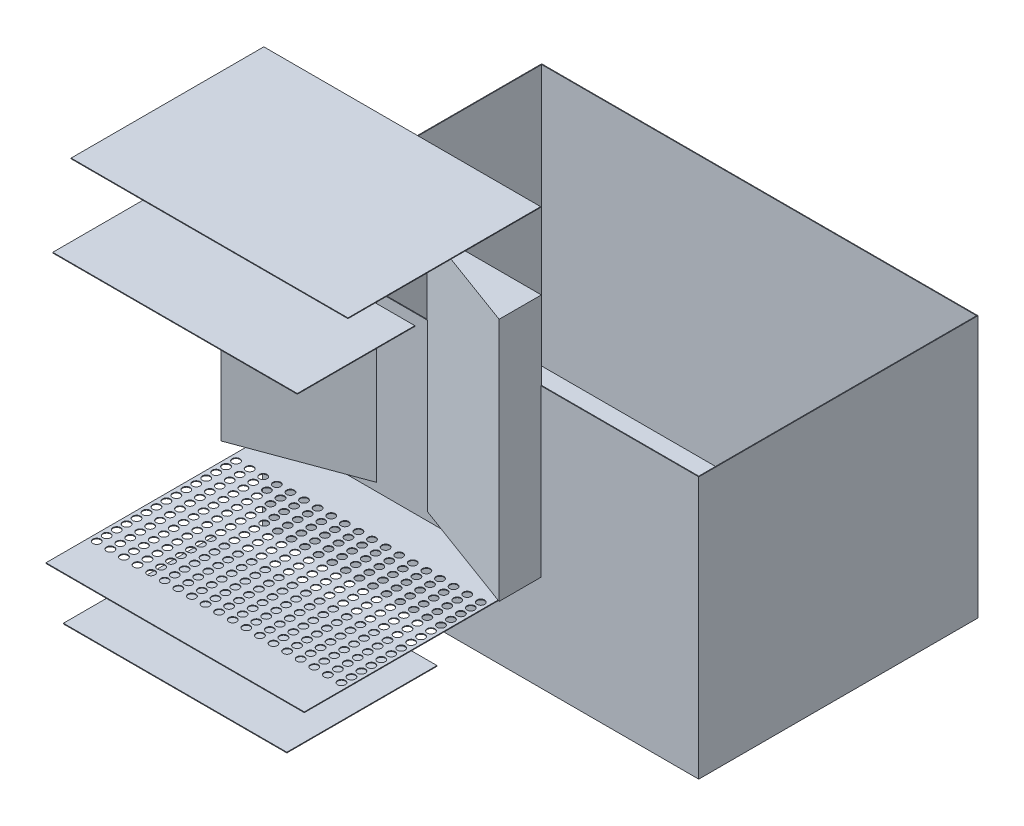
from build123d import *

# Parameters (mm, degrees)
MASTER_FOOTPRINT_W            = 1250
MASTER_FOOTPRINT_H            = 800
BATH_BASE_PLATE_DEPTH         = 750
BATH_SHELL_2MM_T              = -2
INLET_IMPACT_BAFFLE_START     = 125
SKETCH_1_W                    = 640
SKETCH_1_H                    = 430
INLET_IMPACT_BAFFLE_DEPTH     = 2
DISTRIBUTOR_D22_START         = 250
SKETCH_2_W                    = 740
SKETCH_2_H                    = 652
SKETCH_2_R                    = 11
DISTRIBUTOR_D22_DEPTH         = 2
OUTLET_SUBMERGED_BAFFLE_START = 1030
SKETCH_3_W                    = 700.526315789
SKETCH_3_H                    = 336.5
OUTLET_SUBMERGED_BAFFLE_DEPTH = 2
OVERFLOW_WEIR_Z550_START      = 1190
SKETCH_4_W                    = 793
SKETCH_4_H                    = 552
OVERFLOW_WEIR_Z550_DEPTH      = 2
SLOPED_SEDIMENT_FLOOR_START   = 275
SLOPED_SEDIMENT_FLOOR_DEPTH   = 700


with BuildPart() as part:
    # MASTER_FOOTPRINT → BATH_BASE_PLATE (new body)
    with BuildSketch(Plane(origin=(0, 0, 0), x_dir=(1, 0, 0), z_dir=(0, 1, 0))):
        with Locations((625, 400)):
            Rectangle(MASTER_FOOTPRINT_W, MASTER_FOOTPRINT_H)
    extrude(amount=BATH_BASE_PLATE_DEPTH)

    # BATH_SHELL_2MM
    bath_shell_2mm_openings = [part.faces().sort_by_distance(p)[0] for p in [
        (625, 750, -400),
    ]]
    offset(amount=BATH_SHELL_2MM_T, openings=bath_shell_2mm_openings, kind=Kind.INTERSECTION)

    # Эскиз5 → SLOPED_SEDIMENT_FLOOR (add)
    with BuildSketch(Plane(origin=(0, 0, 0), x_dir=(1, 0, 0), z_dir=(0, 1, 0)).offset(SLOPED_SEDIMENT_FLOOR_START)):
        Polygon((2, 1), (2, -120), (330, 1), align=None)
        Polygon((798, 1), (798, -120), (470, 1), align=None)
    extrude(amount=SLOPED_SEDIMENT_FLOOR_DEPTH)


with BuildPart() as body_2:
    # Эскиз1 → INLET_IMPACT_BAFFLE (new body)
    with BuildSketch(Plane(origin=(0, 0, 0), x_dir=(1, 0, 0), z_dir=(0, 1, 0)).offset(INLET_IMPACT_BAFFLE_START)):
        with Locations((400, -435)):
            Rectangle(SKETCH_1_W, SKETCH_1_H)
    extrude(amount=INLET_IMPACT_BAFFLE_DEPTH)


with BuildPart() as body_3:
    # Эскиз2 → DISTRIBUTOR_D22 (new body)
    with BuildSketch(Plane(origin=(0, 0, 0), x_dir=(1, 0, 0), z_dir=(0, 1, 0)).offset(DISTRIBUTOR_D22_START)):
        with Locations((400, -324)):
            Rectangle(SKETCH_2_W, SKETCH_2_H)
        with Locations((49.473684211, -125)):
            Circle(SKETCH_2_R, mode=Mode.SUBTRACT)
        with Locations((49.473684211, -153.5)):
            Circle(SKETCH_2_R, mode=Mode.SUBTRACT)
        with Locations((49.473684211, -182)):
            Circle(SKETCH_2_R, mode=Mode.SUBTRACT)
        with Locations((49.473684211, -210.5)):
            Circle(SKETCH_2_R, mode=Mode.SUBTRACT)
        with Locations((49.473684211, -239)):
            Circle(SKETCH_2_R, mode=Mode.SUBTRACT)
        with Locations((49.473684211, -267.5)):
            Circle(SKETCH_2_R, mode=Mode.SUBTRACT)
        with Locations((49.473684211, -296)):
            Circle(SKETCH_2_R, mode=Mode.SUBTRACT)
        with Locations((49.473684211, -324.5)):
            Circle(SKETCH_2_R, mode=Mode.SUBTRACT)
        with Locations((49.473684211, -353)):
            Circle(SKETCH_2_R, mode=Mode.SUBTRACT)
        with Locations((49.473684211, -381.5)):
            Circle(SKETCH_2_R, mode=Mode.SUBTRACT)
        with Locations((49.473684211, -410)):
            Circle(SKETCH_2_R, mode=Mode.SUBTRACT)
        with Locations((49.473684211, -438.5)):
            Circle(SKETCH_2_R, mode=Mode.SUBTRACT)
        with Locations((49.473684211, -467)):
            Circle(SKETCH_2_R, mode=Mode.SUBTRACT)
        with Locations((49.473684211, -495.5)):
            Circle(SKETCH_2_R, mode=Mode.SUBTRACT)
        with Locations((49.473684211, -524)):
            Circle(SKETCH_2_R, mode=Mode.SUBTRACT)
        with Locations((88.421052632, -125)):
            Circle(SKETCH_2_R, mode=Mode.SUBTRACT)
        with Locations((88.421052632, -153.5)):
            Circle(SKETCH_2_R, mode=Mode.SUBTRACT)
        with Locations((88.421052632, -182)):
            Circle(SKETCH_2_R, mode=Mode.SUBTRACT)
        with Locations((88.421052632, -210.5)):
            Circle(SKETCH_2_R, mode=Mode.SUBTRACT)
        with Locations((88.421052632, -239)):
            Circle(SKETCH_2_R, mode=Mode.SUBTRACT)
        with Locations((88.421052632, -267.5)):
            Circle(SKETCH_2_R, mode=Mode.SUBTRACT)
        with Locations((88.421052632, -296)):
            Circle(SKETCH_2_R, mode=Mode.SUBTRACT)
        with Locations((88.421052632, -324.5)):
            Circle(SKETCH_2_R, mode=Mode.SUBTRACT)
        with Locations((88.421052632, -353)):
            Circle(SKETCH_2_R, mode=Mode.SUBTRACT)
        with Locations((88.421052632, -381.5)):
            Circle(SKETCH_2_R, mode=Mode.SUBTRACT)
        with Locations((88.421052632, -410)):
            Circle(SKETCH_2_R, mode=Mode.SUBTRACT)
        with Locations((88.421052632, -438.5)):
            Circle(SKETCH_2_R, mode=Mode.SUBTRACT)
        with Locations((88.421052632, -467)):
            Circle(SKETCH_2_R, mode=Mode.SUBTRACT)
        with Locations((88.421052632, -495.5)):
            Circle(SKETCH_2_R, mode=Mode.SUBTRACT)
        with Locations((88.421052632, -524)):
            Circle(SKETCH_2_R, mode=Mode.SUBTRACT)
        with Locations((127.368421053, -125)):
            Circle(SKETCH_2_R, mode=Mode.SUBTRACT)
        with Locations((127.368421053, -153.5)):
            Circle(SKETCH_2_R, mode=Mode.SUBTRACT)
        with Locations((127.368421053, -182)):
            Circle(SKETCH_2_R, mode=Mode.SUBTRACT)
        with Locations((127.368421053, -210.5)):
            Circle(SKETCH_2_R, mode=Mode.SUBTRACT)
        with Locations((127.368421053, -239)):
            Circle(SKETCH_2_R, mode=Mode.SUBTRACT)
        with Locations((127.368421053, -267.5)):
            Circle(SKETCH_2_R, mode=Mode.SUBTRACT)
        with Locations((127.368421053, -296)):
            Circle(SKETCH_2_R, mode=Mode.SUBTRACT)
        with Locations((127.368421053, -324.5)):
            Circle(SKETCH_2_R, mode=Mode.SUBTRACT)
        with Locations((127.368421053, -353)):
            Circle(SKETCH_2_R, mode=Mode.SUBTRACT)
        with Locations((127.368421053, -381.5)):
            Circle(SKETCH_2_R, mode=Mode.SUBTRACT)
        with Locations((127.368421053, -410)):
            Circle(SKETCH_2_R, mode=Mode.SUBTRACT)
        with Locations((127.368421053, -438.5)):
            Circle(SKETCH_2_R, mode=Mode.SUBTRACT)
        with Locations((127.368421053, -467)):
            Circle(SKETCH_2_R, mode=Mode.SUBTRACT)
        with Locations((127.368421053, -495.5)):
            Circle(SKETCH_2_R, mode=Mode.SUBTRACT)
        with Locations((127.368421053, -524)):
            Circle(SKETCH_2_R, mode=Mode.SUBTRACT)
        with Locations((166.315789474, -125)):
            Circle(SKETCH_2_R, mode=Mode.SUBTRACT)
        with Locations((166.315789474, -153.5)):
            Circle(SKETCH_2_R, mode=Mode.SUBTRACT)
        with Locations((166.315789474, -182)):
            Circle(SKETCH_2_R, mode=Mode.SUBTRACT)
        with Locations((166.315789474, -210.5)):
            Circle(SKETCH_2_R, mode=Mode.SUBTRACT)
        with Locations((166.315789474, -239)):
            Circle(SKETCH_2_R, mode=Mode.SUBTRACT)
        with Locations((166.315789474, -267.5)):
            Circle(SKETCH_2_R, mode=Mode.SUBTRACT)
        with Locations((166.315789474, -296)):
            Circle(SKETCH_2_R, mode=Mode.SUBTRACT)
        with Locations((166.315789474, -324.5)):
            Circle(SKETCH_2_R, mode=Mode.SUBTRACT)
        with Locations((166.315789474, -353)):
            Circle(SKETCH_2_R, mode=Mode.SUBTRACT)
        with Locations((166.315789474, -381.5)):
            Circle(SKETCH_2_R, mode=Mode.SUBTRACT)
        with Locations((166.315789474, -410)):
            Circle(SKETCH_2_R, mode=Mode.SUBTRACT)
        with Locations((166.315789474, -438.5)):
            Circle(SKETCH_2_R, mode=Mode.SUBTRACT)
        with Locations((166.315789474, -467)):
            Circle(SKETCH_2_R, mode=Mode.SUBTRACT)
        with Locations((166.315789474, -495.5)):
            Circle(SKETCH_2_R, mode=Mode.SUBTRACT)
        with Locations((166.315789474, -524)):
            Circle(SKETCH_2_R, mode=Mode.SUBTRACT)
        with Locations((205.263157895, -125)):
            Circle(SKETCH_2_R, mode=Mode.SUBTRACT)
        with Locations((205.263157895, -153.5)):
            Circle(SKETCH_2_R, mode=Mode.SUBTRACT)
        with Locations((205.263157895, -182)):
            Circle(SKETCH_2_R, mode=Mode.SUBTRACT)
        with Locations((205.263157895, -210.5)):
            Circle(SKETCH_2_R, mode=Mode.SUBTRACT)
        with Locations((205.263157895, -239)):
            Circle(SKETCH_2_R, mode=Mode.SUBTRACT)
        with Locations((205.263157895, -267.5)):
            Circle(SKETCH_2_R, mode=Mode.SUBTRACT)
        with Locations((205.263157895, -296)):
            Circle(SKETCH_2_R, mode=Mode.SUBTRACT)
        with Locations((205.263157895, -324.5)):
            Circle(SKETCH_2_R, mode=Mode.SUBTRACT)
        with Locations((205.263157895, -353)):
            Circle(SKETCH_2_R, mode=Mode.SUBTRACT)
        with Locations((205.263157895, -381.5)):
            Circle(SKETCH_2_R, mode=Mode.SUBTRACT)
        with Locations((205.263157895, -410)):
            Circle(SKETCH_2_R, mode=Mode.SUBTRACT)
        with Locations((205.263157895, -438.5)):
            Circle(SKETCH_2_R, mode=Mode.SUBTRACT)
        with Locations((205.263157895, -467)):
            Circle(SKETCH_2_R, mode=Mode.SUBTRACT)
        with Locations((205.263157895, -495.5)):
            Circle(SKETCH_2_R, mode=Mode.SUBTRACT)
        with Locations((205.263157895, -524)):
            Circle(SKETCH_2_R, mode=Mode.SUBTRACT)
        with Locations((244.210526316, -125)):
            Circle(SKETCH_2_R, mode=Mode.SUBTRACT)
        with Locations((244.210526316, -153.5)):
            Circle(SKETCH_2_R, mode=Mode.SUBTRACT)
        with Locations((244.210526316, -182)):
            Circle(SKETCH_2_R, mode=Mode.SUBTRACT)
        with Locations((244.210526316, -210.5)):
            Circle(SKETCH_2_R, mode=Mode.SUBTRACT)
        with Locations((244.210526316, -239)):
            Circle(SKETCH_2_R, mode=Mode.SUBTRACT)
        with Locations((244.210526316, -267.5)):
            Circle(SKETCH_2_R, mode=Mode.SUBTRACT)
        with Locations((244.210526316, -296)):
            Circle(SKETCH_2_R, mode=Mode.SUBTRACT)
        with Locations((244.210526316, -324.5)):
            Circle(SKETCH_2_R, mode=Mode.SUBTRACT)
        with Locations((244.210526316, -353)):
            Circle(SKETCH_2_R, mode=Mode.SUBTRACT)
        with Locations((244.210526316, -381.5)):
            Circle(SKETCH_2_R, mode=Mode.SUBTRACT)
        with Locations((244.210526316, -410)):
            Circle(SKETCH_2_R, mode=Mode.SUBTRACT)
        with Locations((244.210526316, -438.5)):
            Circle(SKETCH_2_R, mode=Mode.SUBTRACT)
        with Locations((244.210526316, -467)):
            Circle(SKETCH_2_R, mode=Mode.SUBTRACT)
        with Locations((244.210526316, -495.5)):
            Circle(SKETCH_2_R, mode=Mode.SUBTRACT)
        with Locations((244.210526316, -524)):
            Circle(SKETCH_2_R, mode=Mode.SUBTRACT)
        with Locations((283.157894737, -125)):
            Circle(SKETCH_2_R, mode=Mode.SUBTRACT)
        with Locations((283.157894737, -153.5)):
            Circle(SKETCH_2_R, mode=Mode.SUBTRACT)
        with Locations((283.157894737, -182)):
            Circle(SKETCH_2_R, mode=Mode.SUBTRACT)
        with Locations((283.157894737, -210.5)):
            Circle(SKETCH_2_R, mode=Mode.SUBTRACT)
        with Locations((283.157894737, -239)):
            Circle(SKETCH_2_R, mode=Mode.SUBTRACT)
        with Locations((283.157894737, -267.5)):
            Circle(SKETCH_2_R, mode=Mode.SUBTRACT)
        with Locations((283.157894737, -296)):
            Circle(SKETCH_2_R, mode=Mode.SUBTRACT)
        with Locations((283.157894737, -324.5)):
            Circle(SKETCH_2_R, mode=Mode.SUBTRACT)
        with Locations((283.157894737, -353)):
            Circle(SKETCH_2_R, mode=Mode.SUBTRACT)
        with Locations((283.157894737, -381.5)):
            Circle(SKETCH_2_R, mode=Mode.SUBTRACT)
        with Locations((283.157894737, -410)):
            Circle(SKETCH_2_R, mode=Mode.SUBTRACT)
        with Locations((283.157894737, -438.5)):
            Circle(SKETCH_2_R, mode=Mode.SUBTRACT)
        with Locations((283.157894737, -467)):
            Circle(SKETCH_2_R, mode=Mode.SUBTRACT)
        with Locations((283.157894737, -495.5)):
            Circle(SKETCH_2_R, mode=Mode.SUBTRACT)
        with Locations((283.157894737, -524)):
            Circle(SKETCH_2_R, mode=Mode.SUBTRACT)
        with Locations((322.105263158, -125)):
            Circle(SKETCH_2_R, mode=Mode.SUBTRACT)
        with Locations((322.105263158, -153.5)):
            Circle(SKETCH_2_R, mode=Mode.SUBTRACT)
        with Locations((322.105263158, -182)):
            Circle(SKETCH_2_R, mode=Mode.SUBTRACT)
        with Locations((322.105263158, -210.5)):
            Circle(SKETCH_2_R, mode=Mode.SUBTRACT)
        with Locations((322.105263158, -239)):
            Circle(SKETCH_2_R, mode=Mode.SUBTRACT)
        with Locations((322.105263158, -267.5)):
            Circle(SKETCH_2_R, mode=Mode.SUBTRACT)
        with Locations((322.105263158, -296)):
            Circle(SKETCH_2_R, mode=Mode.SUBTRACT)
        with Locations((322.105263158, -324.5)):
            Circle(SKETCH_2_R, mode=Mode.SUBTRACT)
        with Locations((322.105263158, -353)):
            Circle(SKETCH_2_R, mode=Mode.SUBTRACT)
        with Locations((322.105263158, -381.5)):
            Circle(SKETCH_2_R, mode=Mode.SUBTRACT)
        with Locations((322.105263158, -410)):
            Circle(SKETCH_2_R, mode=Mode.SUBTRACT)
        with Locations((322.105263158, -438.5)):
            Circle(SKETCH_2_R, mode=Mode.SUBTRACT)
        with Locations((322.105263158, -467)):
            Circle(SKETCH_2_R, mode=Mode.SUBTRACT)
        with Locations((322.105263158, -495.5)):
            Circle(SKETCH_2_R, mode=Mode.SUBTRACT)
        with Locations((322.105263158, -524)):
            Circle(SKETCH_2_R, mode=Mode.SUBTRACT)
        with Locations((361.052631579, -125)):
            Circle(SKETCH_2_R, mode=Mode.SUBTRACT)
        with Locations((361.052631579, -153.5)):
            Circle(SKETCH_2_R, mode=Mode.SUBTRACT)
        with Locations((361.052631579, -182)):
            Circle(SKETCH_2_R, mode=Mode.SUBTRACT)
        with Locations((361.052631579, -210.5)):
            Circle(SKETCH_2_R, mode=Mode.SUBTRACT)
        with Locations((361.052631579, -239)):
            Circle(SKETCH_2_R, mode=Mode.SUBTRACT)
        with Locations((361.052631579, -267.5)):
            Circle(SKETCH_2_R, mode=Mode.SUBTRACT)
        with Locations((361.052631579, -296)):
            Circle(SKETCH_2_R, mode=Mode.SUBTRACT)
        with Locations((361.052631579, -324.5)):
            Circle(SKETCH_2_R, mode=Mode.SUBTRACT)
        with Locations((361.052631579, -353)):
            Circle(SKETCH_2_R, mode=Mode.SUBTRACT)
        with Locations((361.052631579, -381.5)):
            Circle(SKETCH_2_R, mode=Mode.SUBTRACT)
        with Locations((361.052631579, -410)):
            Circle(SKETCH_2_R, mode=Mode.SUBTRACT)
        with Locations((361.052631579, -438.5)):
            Circle(SKETCH_2_R, mode=Mode.SUBTRACT)
        with Locations((361.052631579, -467)):
            Circle(SKETCH_2_R, mode=Mode.SUBTRACT)
        with Locations((361.052631579, -495.5)):
            Circle(SKETCH_2_R, mode=Mode.SUBTRACT)
        with Locations((361.052631579, -524)):
            Circle(SKETCH_2_R, mode=Mode.SUBTRACT)
        with Locations((400, -125)):
            Circle(SKETCH_2_R, mode=Mode.SUBTRACT)
        with Locations((400, -153.5)):
            Circle(SKETCH_2_R, mode=Mode.SUBTRACT)
        with Locations((400, -182)):
            Circle(SKETCH_2_R, mode=Mode.SUBTRACT)
        with Locations((400, -210.5)):
            Circle(SKETCH_2_R, mode=Mode.SUBTRACT)
        with Locations((400, -239)):
            Circle(SKETCH_2_R, mode=Mode.SUBTRACT)
        with Locations((400, -267.5)):
            Circle(SKETCH_2_R, mode=Mode.SUBTRACT)
        with Locations((400, -296)):
            Circle(SKETCH_2_R, mode=Mode.SUBTRACT)
        with Locations((400, -324.5)):
            Circle(SKETCH_2_R, mode=Mode.SUBTRACT)
        with Locations((400, -353)):
            Circle(SKETCH_2_R, mode=Mode.SUBTRACT)
        with Locations((400, -381.5)):
            Circle(SKETCH_2_R, mode=Mode.SUBTRACT)
        with Locations((400, -410)):
            Circle(SKETCH_2_R, mode=Mode.SUBTRACT)
        with Locations((400, -438.5)):
            Circle(SKETCH_2_R, mode=Mode.SUBTRACT)
        with Locations((400, -467)):
            Circle(SKETCH_2_R, mode=Mode.SUBTRACT)
        with Locations((400, -495.5)):
            Circle(SKETCH_2_R, mode=Mode.SUBTRACT)
        with Locations((400, -524)):
            Circle(SKETCH_2_R, mode=Mode.SUBTRACT)
        with Locations((438.947368421, -125)):
            Circle(SKETCH_2_R, mode=Mode.SUBTRACT)
        with Locations((438.947368421, -153.5)):
            Circle(SKETCH_2_R, mode=Mode.SUBTRACT)
        with Locations((438.947368421, -182)):
            Circle(SKETCH_2_R, mode=Mode.SUBTRACT)
        with Locations((438.947368421, -210.5)):
            Circle(SKETCH_2_R, mode=Mode.SUBTRACT)
        with Locations((438.947368421, -239)):
            Circle(SKETCH_2_R, mode=Mode.SUBTRACT)
        with Locations((438.947368421, -267.5)):
            Circle(SKETCH_2_R, mode=Mode.SUBTRACT)
        with Locations((438.947368421, -296)):
            Circle(SKETCH_2_R, mode=Mode.SUBTRACT)
        with Locations((438.947368421, -324.5)):
            Circle(SKETCH_2_R, mode=Mode.SUBTRACT)
        with Locations((438.947368421, -353)):
            Circle(SKETCH_2_R, mode=Mode.SUBTRACT)
        with Locations((438.947368421, -381.5)):
            Circle(SKETCH_2_R, mode=Mode.SUBTRACT)
        with Locations((438.947368421, -410)):
            Circle(SKETCH_2_R, mode=Mode.SUBTRACT)
        with Locations((438.947368421, -438.5)):
            Circle(SKETCH_2_R, mode=Mode.SUBTRACT)
        with Locations((438.947368421, -467)):
            Circle(SKETCH_2_R, mode=Mode.SUBTRACT)
        with Locations((438.947368421, -495.5)):
            Circle(SKETCH_2_R, mode=Mode.SUBTRACT)
        with Locations((438.947368421, -524)):
            Circle(SKETCH_2_R, mode=Mode.SUBTRACT)
        with Locations((477.894736842, -125)):
            Circle(SKETCH_2_R, mode=Mode.SUBTRACT)
        with Locations((477.894736842, -153.5)):
            Circle(SKETCH_2_R, mode=Mode.SUBTRACT)
        with Locations((477.894736842, -182)):
            Circle(SKETCH_2_R, mode=Mode.SUBTRACT)
        with Locations((477.894736842, -210.5)):
            Circle(SKETCH_2_R, mode=Mode.SUBTRACT)
        with Locations((477.894736842, -239)):
            Circle(SKETCH_2_R, mode=Mode.SUBTRACT)
        with Locations((477.894736842, -267.5)):
            Circle(SKETCH_2_R, mode=Mode.SUBTRACT)
        with Locations((477.894736842, -296)):
            Circle(SKETCH_2_R, mode=Mode.SUBTRACT)
        with Locations((477.894736842, -324.5)):
            Circle(SKETCH_2_R, mode=Mode.SUBTRACT)
        with Locations((477.894736842, -353)):
            Circle(SKETCH_2_R, mode=Mode.SUBTRACT)
        with Locations((477.894736842, -381.5)):
            Circle(SKETCH_2_R, mode=Mode.SUBTRACT)
        with Locations((477.894736842, -410)):
            Circle(SKETCH_2_R, mode=Mode.SUBTRACT)
        with Locations((477.894736842, -438.5)):
            Circle(SKETCH_2_R, mode=Mode.SUBTRACT)
        with Locations((477.894736842, -467)):
            Circle(SKETCH_2_R, mode=Mode.SUBTRACT)
        with Locations((477.894736842, -495.5)):
            Circle(SKETCH_2_R, mode=Mode.SUBTRACT)
        with Locations((477.894736842, -524)):
            Circle(SKETCH_2_R, mode=Mode.SUBTRACT)
        with Locations((516.842105263, -125)):
            Circle(SKETCH_2_R, mode=Mode.SUBTRACT)
        with Locations((516.842105263, -153.5)):
            Circle(SKETCH_2_R, mode=Mode.SUBTRACT)
        with Locations((516.842105263, -182)):
            Circle(SKETCH_2_R, mode=Mode.SUBTRACT)
        with Locations((516.842105263, -210.5)):
            Circle(SKETCH_2_R, mode=Mode.SUBTRACT)
        with Locations((516.842105263, -239)):
            Circle(SKETCH_2_R, mode=Mode.SUBTRACT)
        with Locations((516.842105263, -267.5)):
            Circle(SKETCH_2_R, mode=Mode.SUBTRACT)
        with Locations((516.842105263, -296)):
            Circle(SKETCH_2_R, mode=Mode.SUBTRACT)
        with Locations((516.842105263, -324.5)):
            Circle(SKETCH_2_R, mode=Mode.SUBTRACT)
        with Locations((516.842105263, -353)):
            Circle(SKETCH_2_R, mode=Mode.SUBTRACT)
        with Locations((516.842105263, -381.5)):
            Circle(SKETCH_2_R, mode=Mode.SUBTRACT)
        with Locations((516.842105263, -410)):
            Circle(SKETCH_2_R, mode=Mode.SUBTRACT)
        with Locations((516.842105263, -438.5)):
            Circle(SKETCH_2_R, mode=Mode.SUBTRACT)
        with Locations((516.842105263, -467)):
            Circle(SKETCH_2_R, mode=Mode.SUBTRACT)
        with Locations((516.842105263, -495.5)):
            Circle(SKETCH_2_R, mode=Mode.SUBTRACT)
        with Locations((516.842105263, -524)):
            Circle(SKETCH_2_R, mode=Mode.SUBTRACT)
        with Locations((555.789473684, -125)):
            Circle(SKETCH_2_R, mode=Mode.SUBTRACT)
        with Locations((555.789473684, -153.5)):
            Circle(SKETCH_2_R, mode=Mode.SUBTRACT)
        with Locations((555.789473684, -182)):
            Circle(SKETCH_2_R, mode=Mode.SUBTRACT)
        with Locations((555.789473684, -210.5)):
            Circle(SKETCH_2_R, mode=Mode.SUBTRACT)
        with Locations((555.789473684, -239)):
            Circle(SKETCH_2_R, mode=Mode.SUBTRACT)
        with Locations((555.789473684, -267.5)):
            Circle(SKETCH_2_R, mode=Mode.SUBTRACT)
        with Locations((555.789473684, -296)):
            Circle(SKETCH_2_R, mode=Mode.SUBTRACT)
        with Locations((555.789473684, -324.5)):
            Circle(SKETCH_2_R, mode=Mode.SUBTRACT)
        with Locations((555.789473684, -353)):
            Circle(SKETCH_2_R, mode=Mode.SUBTRACT)
        with Locations((555.789473684, -381.5)):
            Circle(SKETCH_2_R, mode=Mode.SUBTRACT)
        with Locations((555.789473684, -410)):
            Circle(SKETCH_2_R, mode=Mode.SUBTRACT)
        with Locations((555.789473684, -438.5)):
            Circle(SKETCH_2_R, mode=Mode.SUBTRACT)
        with Locations((555.789473684, -467)):
            Circle(SKETCH_2_R, mode=Mode.SUBTRACT)
        with Locations((555.789473684, -495.5)):
            Circle(SKETCH_2_R, mode=Mode.SUBTRACT)
        with Locations((555.789473684, -524)):
            Circle(SKETCH_2_R, mode=Mode.SUBTRACT)
        with Locations((594.736842105, -125)):
            Circle(SKETCH_2_R, mode=Mode.SUBTRACT)
        with Locations((594.736842105, -153.5)):
            Circle(SKETCH_2_R, mode=Mode.SUBTRACT)
        with Locations((594.736842105, -182)):
            Circle(SKETCH_2_R, mode=Mode.SUBTRACT)
        with Locations((594.736842105, -210.5)):
            Circle(SKETCH_2_R, mode=Mode.SUBTRACT)
        with Locations((594.736842105, -239)):
            Circle(SKETCH_2_R, mode=Mode.SUBTRACT)
        with Locations((594.736842105, -267.5)):
            Circle(SKETCH_2_R, mode=Mode.SUBTRACT)
        with Locations((594.736842105, -296)):
            Circle(SKETCH_2_R, mode=Mode.SUBTRACT)
        with Locations((594.736842105, -324.5)):
            Circle(SKETCH_2_R, mode=Mode.SUBTRACT)
        with Locations((594.736842105, -353)):
            Circle(SKETCH_2_R, mode=Mode.SUBTRACT)
        with Locations((594.736842105, -381.5)):
            Circle(SKETCH_2_R, mode=Mode.SUBTRACT)
        with Locations((594.736842105, -410)):
            Circle(SKETCH_2_R, mode=Mode.SUBTRACT)
        with Locations((594.736842105, -438.5)):
            Circle(SKETCH_2_R, mode=Mode.SUBTRACT)
        with Locations((594.736842105, -467)):
            Circle(SKETCH_2_R, mode=Mode.SUBTRACT)
        with Locations((594.736842105, -495.5)):
            Circle(SKETCH_2_R, mode=Mode.SUBTRACT)
        with Locations((594.736842105, -524)):
            Circle(SKETCH_2_R, mode=Mode.SUBTRACT)
        with Locations((633.684210526, -125)):
            Circle(SKETCH_2_R, mode=Mode.SUBTRACT)
        with Locations((633.684210526, -153.5)):
            Circle(SKETCH_2_R, mode=Mode.SUBTRACT)
        with Locations((633.684210526, -182)):
            Circle(SKETCH_2_R, mode=Mode.SUBTRACT)
        with Locations((633.684210526, -210.5)):
            Circle(SKETCH_2_R, mode=Mode.SUBTRACT)
        with Locations((633.684210526, -239)):
            Circle(SKETCH_2_R, mode=Mode.SUBTRACT)
        with Locations((633.684210526, -267.5)):
            Circle(SKETCH_2_R, mode=Mode.SUBTRACT)
        with Locations((633.684210526, -296)):
            Circle(SKETCH_2_R, mode=Mode.SUBTRACT)
        with Locations((633.684210526, -324.5)):
            Circle(SKETCH_2_R, mode=Mode.SUBTRACT)
        with Locations((633.684210526, -353)):
            Circle(SKETCH_2_R, mode=Mode.SUBTRACT)
        with Locations((633.684210526, -381.5)):
            Circle(SKETCH_2_R, mode=Mode.SUBTRACT)
        with Locations((633.684210526, -410)):
            Circle(SKETCH_2_R, mode=Mode.SUBTRACT)
        with Locations((633.684210526, -438.5)):
            Circle(SKETCH_2_R, mode=Mode.SUBTRACT)
        with Locations((633.684210526, -467)):
            Circle(SKETCH_2_R, mode=Mode.SUBTRACT)
        with Locations((633.684210526, -495.5)):
            Circle(SKETCH_2_R, mode=Mode.SUBTRACT)
        with Locations((633.684210526, -524)):
            Circle(SKETCH_2_R, mode=Mode.SUBTRACT)
        with Locations((672.631578947, -125)):
            Circle(SKETCH_2_R, mode=Mode.SUBTRACT)
        with Locations((672.631578947, -153.5)):
            Circle(SKETCH_2_R, mode=Mode.SUBTRACT)
        with Locations((672.631578947, -182)):
            Circle(SKETCH_2_R, mode=Mode.SUBTRACT)
        with Locations((672.631578947, -210.5)):
            Circle(SKETCH_2_R, mode=Mode.SUBTRACT)
        with Locations((672.631578947, -239)):
            Circle(SKETCH_2_R, mode=Mode.SUBTRACT)
        with Locations((672.631578947, -267.5)):
            Circle(SKETCH_2_R, mode=Mode.SUBTRACT)
        with Locations((672.631578947, -296)):
            Circle(SKETCH_2_R, mode=Mode.SUBTRACT)
        with Locations((672.631578947, -324.5)):
            Circle(SKETCH_2_R, mode=Mode.SUBTRACT)
        with Locations((672.631578947, -353)):
            Circle(SKETCH_2_R, mode=Mode.SUBTRACT)
        with Locations((672.631578947, -381.5)):
            Circle(SKETCH_2_R, mode=Mode.SUBTRACT)
        with Locations((672.631578947, -410)):
            Circle(SKETCH_2_R, mode=Mode.SUBTRACT)
        with Locations((672.631578947, -438.5)):
            Circle(SKETCH_2_R, mode=Mode.SUBTRACT)
        with Locations((672.631578947, -467)):
            Circle(SKETCH_2_R, mode=Mode.SUBTRACT)
        with Locations((672.631578947, -495.5)):
            Circle(SKETCH_2_R, mode=Mode.SUBTRACT)
        with Locations((672.631578947, -524)):
            Circle(SKETCH_2_R, mode=Mode.SUBTRACT)
        with Locations((711.578947368, -125)):
            Circle(SKETCH_2_R, mode=Mode.SUBTRACT)
        with Locations((711.578947368, -153.5)):
            Circle(SKETCH_2_R, mode=Mode.SUBTRACT)
        with Locations((711.578947368, -182)):
            Circle(SKETCH_2_R, mode=Mode.SUBTRACT)
        with Locations((711.578947368, -210.5)):
            Circle(SKETCH_2_R, mode=Mode.SUBTRACT)
        with Locations((711.578947368, -239)):
            Circle(SKETCH_2_R, mode=Mode.SUBTRACT)
        with Locations((711.578947368, -267.5)):
            Circle(SKETCH_2_R, mode=Mode.SUBTRACT)
        with Locations((711.578947368, -296)):
            Circle(SKETCH_2_R, mode=Mode.SUBTRACT)
        with Locations((711.578947368, -324.5)):
            Circle(SKETCH_2_R, mode=Mode.SUBTRACT)
        with Locations((711.578947368, -353)):
            Circle(SKETCH_2_R, mode=Mode.SUBTRACT)
        with Locations((711.578947368, -381.5)):
            Circle(SKETCH_2_R, mode=Mode.SUBTRACT)
        with Locations((711.578947368, -410)):
            Circle(SKETCH_2_R, mode=Mode.SUBTRACT)
        with Locations((711.578947368, -438.5)):
            Circle(SKETCH_2_R, mode=Mode.SUBTRACT)
        with Locations((711.578947368, -467)):
            Circle(SKETCH_2_R, mode=Mode.SUBTRACT)
        with Locations((711.578947368, -495.5)):
            Circle(SKETCH_2_R, mode=Mode.SUBTRACT)
        with Locations((711.578947368, -524)):
            Circle(SKETCH_2_R, mode=Mode.SUBTRACT)
        with Locations((750.526315789, -125)):
            Circle(SKETCH_2_R, mode=Mode.SUBTRACT)
        with Locations((750.526315789, -153.5)):
            Circle(SKETCH_2_R, mode=Mode.SUBTRACT)
        with Locations((750.526315789, -182)):
            Circle(SKETCH_2_R, mode=Mode.SUBTRACT)
        with Locations((750.526315789, -210.5)):
            Circle(SKETCH_2_R, mode=Mode.SUBTRACT)
        with Locations((750.526315789, -239)):
            Circle(SKETCH_2_R, mode=Mode.SUBTRACT)
        with Locations((750.526315789, -267.5)):
            Circle(SKETCH_2_R, mode=Mode.SUBTRACT)
        with Locations((750.526315789, -296)):
            Circle(SKETCH_2_R, mode=Mode.SUBTRACT)
        with Locations((750.526315789, -324.5)):
            Circle(SKETCH_2_R, mode=Mode.SUBTRACT)
        with Locations((750.526315789, -353)):
            Circle(SKETCH_2_R, mode=Mode.SUBTRACT)
        with Locations((750.526315789, -381.5)):
            Circle(SKETCH_2_R, mode=Mode.SUBTRACT)
        with Locations((750.526315789, -410)):
            Circle(SKETCH_2_R, mode=Mode.SUBTRACT)
        with Locations((750.526315789, -438.5)):
            Circle(SKETCH_2_R, mode=Mode.SUBTRACT)
        with Locations((750.526315789, -467)):
            Circle(SKETCH_2_R, mode=Mode.SUBTRACT)
        with Locations((750.526315789, -495.5)):
            Circle(SKETCH_2_R, mode=Mode.SUBTRACT)
        with Locations((750.526315789, -524)):
            Circle(SKETCH_2_R, mode=Mode.SUBTRACT)
    extrude(amount=DISTRIBUTOR_D22_DEPTH)


with BuildPart() as body_4:
    # Эскиз3 → OUTLET_SUBMERGED_BAFFLE (new body)
    with BuildSketch(Plane(origin=(0, 0, 0), x_dir=(1, 0, 0), z_dir=(0, 1, 0)).offset(OUTLET_SUBMERGED_BAFFLE_START)):
        with Locations((399.736842105, -481.75)):
            Rectangle(SKETCH_3_W, SKETCH_3_H)
    extrude(amount=OUTLET_SUBMERGED_BAFFLE_DEPTH)


with BuildPart() as body_5:
    # Эскиз4 → OVERFLOW_WEIR_Z550 (new body)
    with BuildSketch(Plane(origin=(0, 0, 0), x_dir=(1, 0, 0), z_dir=(0, 1, 0)).offset(OVERFLOW_WEIR_Z550_START)):
        with Locations((398.5, -274)):
            Rectangle(SKETCH_4_W, SKETCH_4_H)
    extrude(amount=OVERFLOW_WEIR_Z550_DEPTH)


solid = Compound([part.part, body_2.part, body_3.part, body_4.part, body_5.part])
